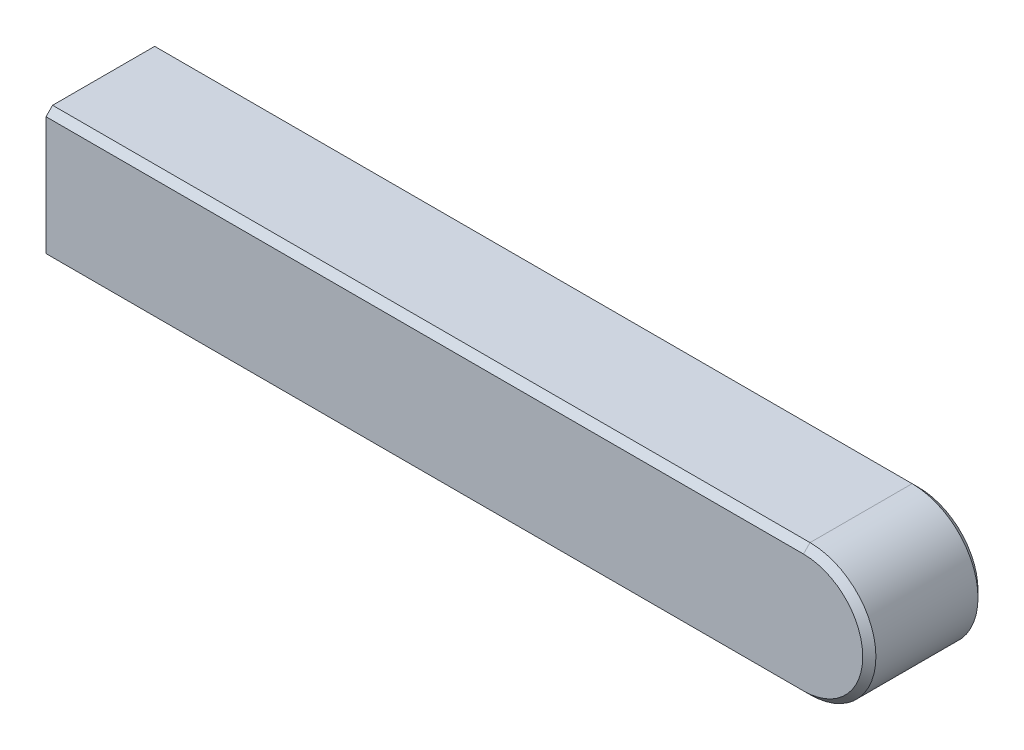
from build123d import *

# Parameters (mm, degrees)
EXTRUDE1_DEPTH = 7
CHAMFER1_SIZE  = 0.4


with BuildPart() as part:
    # body → Extrude1 (new body)
    with BuildSketch(Plane.XY):
        with BuildLine():
            Line((0, 0), (46, 0))
            ThreePointArc((46, 0), (50, 4), (46, 8))
            Line((46, 8), (0, 8))
            Line((0, 8), (0, 0))
        make_face()
    extrude(amount=EXTRUDE1_DEPTH)

    # Chamfer1
    chamfer1_edges = [part.edges().sort_by_distance(p)[0] for p in [
        (23, 0, 0),
        (50, 4, 0),
        (23, 8, 0),
        (23, 0, 7),
        (50, 4, 7),
        (23, 8, 7),
    ]]
    chamfer(chamfer1_edges, length=CHAMFER1_SIZE)


solid = part.part
